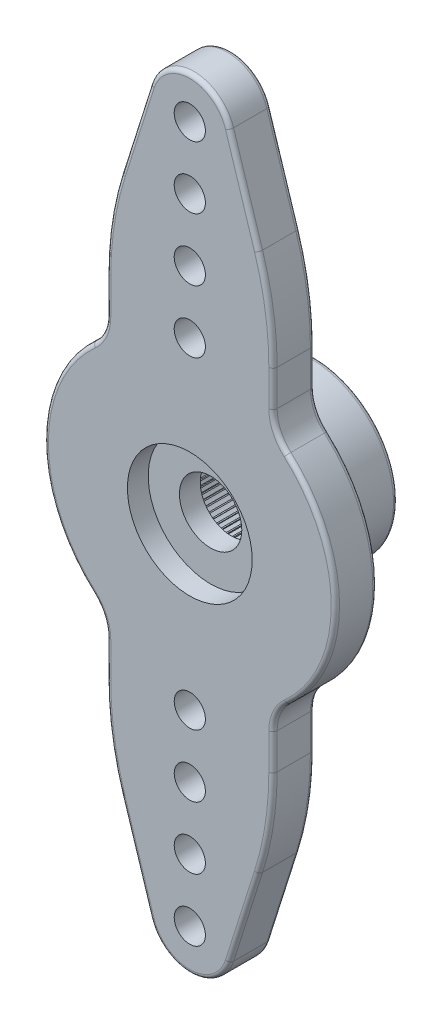
from build123d import *

# Parameters (mm, degrees)
SKETCH1_R                = 7
SKETCH1_R_2              = 1.5
SKETCH1_R_3              = 2
BOSS_EXTRUDE1_DEPTH      = 2
FILLET1_R                = 15
SKETCH2_R                = 0.75
CUT_EXTRUDE1_DEPTH       = 21.113739086
CIRPATTERN2_COUNT        = 2
FILLET1_OF_CIRPATTERN2_R = 15
FILLET2_R                = 2
SKETCH3_R                = 3
CUT_EXTRUDE2_DEPTH       = 1
SKETCH4_R                = 4
SKETCH4_R_2              = 3
BOSS_EXTRUDE2_DEPTH      = 4
SKETCH5_W                = 0.05
SKETCH5_H                = 0.5
BOSS_EXTRUDE3_DEPTH      = 4
CIRPATTERN3_COUNT        = 80
FILLET3_R                = 0.2


with BuildPart() as part:
    # Sketch1 → Boss-Extrude1 (new body)
    # profile 1 of 3: a face of its own
    with BuildSketch(Plane.XY):
        Circle(SKETCH1_R)
        Circle(SKETCH1_R_2, mode=Mode.SUBTRACT)
    # profile 2 of 3: a face of its own
    with BuildSketch(Plane.XY):
        with BuildLine():
            Line((-1.906651599, 17.353887141), (-4, 10.744562647))
            Line((-4, 10.744562647), (-4, 5.744562647))
            ThreePointArc((-4, 5.744562647), (0, 7), (4, 5.744562647))
            Line((4, 5.744562647), (4, 10.744562647))
            Line((4, 10.744562647), (1.906651599, 17.353887141))
            ThreePointArc((1.906651599, 17.353887141), (1.976525132, 17.055529705), (2, 16.75))
            ThreePointArc((2, 16.75), (-0.305529705, 14.773474868), (-1.906651599, 17.353887141))
        make_face()
    # profile 3 of 3: a face of its own
    with BuildSketch(Plane.XY):
        with Locations((0, 16.75)):
            Circle(SKETCH1_R_3)
    boss_extrude1 = extrude(amount=BOSS_EXTRUDE1_DEPTH)

    # Fillet1
    fillet1_edges = [part.edges().sort_by_distance(p)[0] for p in [
        (-4, 10.744562647, 1),
        (4, 10.744562647, 1),
    ]]
    fillet(fillet1_edges, radius=FILLET1_R)

    # Sketch2 → Cut-Extrude1 (cut, through all)
    with BuildSketch(Plane.XY.offset(2)):
        with Locations((0, 16.75)):
            Circle(SKETCH2_R)
        with Locations((0, 13.75)):
            Circle(SKETCH2_R)
        with Locations((0, 10.75)):
            Circle(SKETCH2_R)
        with Locations((0, 7.75)):
            Circle(SKETCH2_R)
    cut_extrude1 = extrude(amount=-CUT_EXTRUDE1_DEPTH, mode=Mode.SUBTRACT)

    # CirPattern2: Boss-Extrude1, Cut-Extrude1 ×2 about axis
    cirpattern2_axis = Axis((0, 0, 0), (0, 0, 1))
    add([boss_extrude1.rotate(cirpattern2_axis, i * 360 / CIRPATTERN2_COUNT) for i in range(1, CIRPATTERN2_COUNT)])
    add([cut_extrude1.rotate(cirpattern2_axis, i * 360 / CIRPATTERN2_COUNT) for i in range(1, CIRPATTERN2_COUNT)], mode=Mode.SUBTRACT)

    # Fillet1 of CirPattern2
    fillet1_of_cirpattern2_edges = [part.edges().sort_by_distance(p)[0] for p in [
        (4, -10.744562647, 1),
        (-4, -10.744562647, 1),
    ]]
    fillet(fillet1_of_cirpattern2_edges, radius=FILLET1_OF_CIRPATTERN2_R)

    # Fillet2
    fillet2_edges = [part.edges().sort_by_distance(p)[0] for p in [
        (-4, 5.744562647, 1),
        (4, 5.744562647, 1),
        (4, -5.744562647, 1),
        (-4, -5.744562647, 1),
    ]]
    fillet(fillet2_edges, radius=FILLET2_R)

    # Sketch3 → Cut-Extrude2 (cut)
    with BuildSketch(Plane.XY.offset(2)):
        Circle(SKETCH3_R)
    extrude(amount=-CUT_EXTRUDE2_DEPTH, mode=Mode.SUBTRACT)

    # Sketch4 → Boss-Extrude2 (add)
    with BuildSketch(Plane(origin=(0, 0, 0), x_dir=(-1, 0, 0), z_dir=(0, 0, -1))):
        with Locations(Location((0, 0, 0), (0, 0, 180))):
            Circle(SKETCH4_R)
        with Locations(Location((0, 0, 0), (0, 0, 180))):
            Circle(SKETCH4_R_2, mode=Mode.SUBTRACT)
    extrude(amount=BOSS_EXTRUDE2_DEPTH)

    # Sketch5 → Boss-Extrude3 (add)
    with BuildSketch(Plane(origin=(0, 0, -4), x_dir=(-1, 0, 0), z_dir=(0, 0, -1))):
        with Locations((0, -3.144105088)):
            Rectangle(SKETCH5_W, SKETCH5_H)
    boss_extrude3 = extrude(amount=-BOSS_EXTRUDE3_DEPTH)

    # CirPattern3: Boss-Extrude3 ×80 about axis
    cirpattern3_axis = Axis((0, 0, 0), (0, 0, 1))
    for i in range(1, CIRPATTERN3_COUNT):
        add(boss_extrude3.rotate(cirpattern3_axis, i * 360 / CIRPATTERN3_COUNT))

    # Fillet3
    fillet3_edges = [part.edges().sort_by_distance(p)[0] for p in [
        (-7, 0, 0),
        (-7, 0, 2),
        (7, 0, 0),
        (7, 0, 2),
        (-4.174258142, 5.891707352, 0),
        (-4.174258142, 5.891707352, 2),
        (-4.174258142, -5.891707352, 0),
        (-4.174258142, -5.891707352, 2),
        (4.174258142, -5.891707352, 0),
        (4.174258142, -5.891707352, 2),
        (4.174258142, 5.891707352, 0),
        (4.174258142, 5.891707352, 2),
        (-4, 0, 0),
        (2.603269296, 15.154457554, 2),
        (-4, 0, -4),
        (0, 18.75, 2),
        (-4, 7.567039169, 0),
        (-4, 7.567039169, 2),
        (-2.603269296, 15.154457554, 2),
        (4, 7.567039169, 0),
        (3.823938493, 10.717347197, 0),
        (-3.823938493, 10.717347197, 0),
        (4, 7.567039169, 2),
        (3.823938493, 10.717347197, 2),
        (-3.823938493, 10.717347197, 2),
        (0, -18.75, 2),
        (2.603269296, -15.154457554, 2),
        (-2.603269296, -15.154457554, 0),
        (-2.603269296, -15.154457554, 2),
        (0, -18.75, 0),
        (2.603269296, -15.154457554, 0),
        (4, -7.567039169, 0),
        (-2.603269296, 15.154457554, 0),
        (4, -7.567039169, 2),
        (-4, -7.567039169, 0),
        (-3.823938493, -10.717347197, 0),
        (3.823938493, -10.717347197, 0),
        (0, 18.75, 0),
        (-4, -7.567039169, 2),
        (-3.823938493, -10.717347197, 2),
        (3.823938493, -10.717347197, 2),
        (2.603269296, 15.154457554, 0),
    ]]
    fillet(fillet3_edges, radius=FILLET3_R)


solid = part.part
